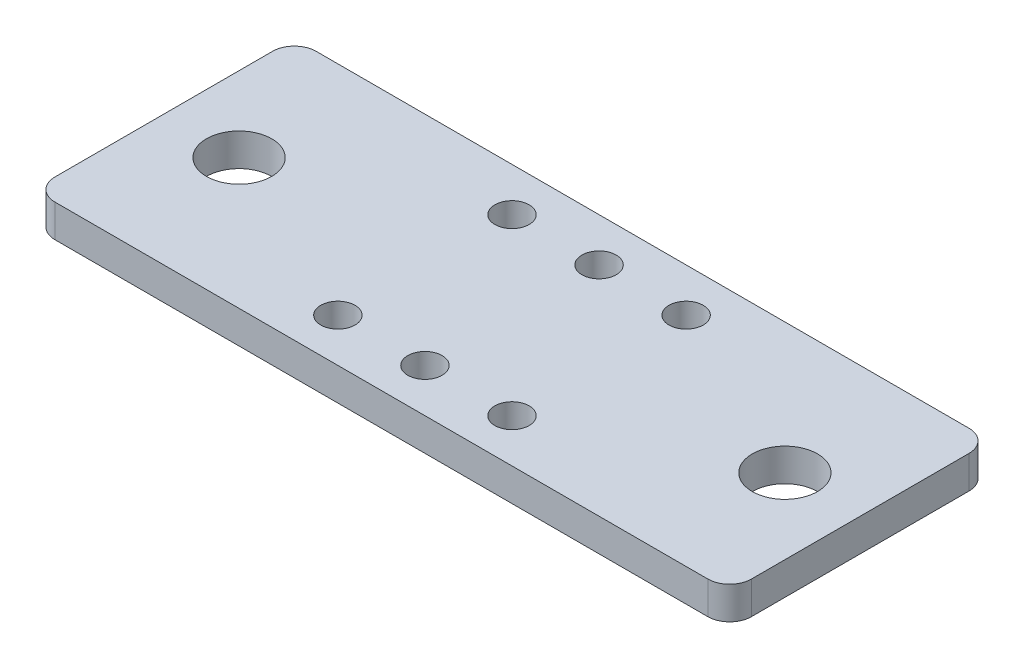
from build123d import *

# Parameters (mm, degrees)
ESQUISSE1_W                   = 101.6
ESQUISSE1_H                   = 38.1
T_LE_DE_BASE_PLI_E1_DEPTH     = 4.76
ESQUISSE13_R                  = 4.7625
ENL_V_MAT_EXTRU_3_DEPTH       = 55.46283228
DIAM_TRE_DU_PER_AGE_5_0_5_1_D = 5
R_P_TITION_LIN_AIRE1_COUNT    = 2
R_P_TITION_LIN_AIRE1_PITCH    = 25.4
CONG_2_R                      = 3.175


# Sheet-metal steps are written as plain solids
with BuildPart() as part:
    # Esquisse1 → Tôle de base pliée1 (new body)
    with BuildSketch(Plane(origin=(0, 0, 0), x_dir=(1, 0, 0), z_dir=(0, 1, 0))):
        Rectangle(ESQUISSE1_W, ESQUISSE1_H)
    extrude(amount=-T_LE_DE_BASE_PLI_E1_DEPTH)

    # Esquisse13 → Enlèv. mat.-Extru.3 (cut, through all)
    with BuildSketch(Plane(origin=(0, 0, 0), x_dir=(1, 0, 0), z_dir=(0, 1, 0))):
        with Locations(Location((-39.8145, 0, 0), (0, 0, 270))):
            Circle(ESQUISSE13_R)
        with Locations(Location((39.8145, 0, 0), (0, 0, 90))):
            Circle(ESQUISSE13_R)
    extrude(amount=-ENL_V_MAT_EXTRU_3_DEPTH, mode=Mode.SUBTRACT)

    # Diamètre du perçage Ø5.0 (5)1 (through all)
    with Locations(Plane(origin=(0, 0, 0), x_dir=(1, 0, 0), z_dir=(0, 1, 0))):
        with Locations((-12.7, 12.7), (0, 12.7), (12.7, 12.7)):
            diam_tre_du_per_age_5_0_5_1 = Hole(DIAM_TRE_DU_PER_AGE_5_0_5_1_D / 2)

    # Répétition linéaire1: Diamètre du perçage Ø5.0 (5)1 ×2
    with Locations(*[(0, 0, i * R_P_TITION_LIN_AIRE1_PITCH) for i in range(1, R_P_TITION_LIN_AIRE1_COUNT)]):
        add(diam_tre_du_per_age_5_0_5_1, mode=Mode.SUBTRACT)

    # Congé2
    cong_2_edges = [part.edges().sort_by_distance(p)[0] for p in [
        (-50.8, -2.38, -19.05),
        (50.8, -2.38, -19.05),
        (50.8, -2.38, 19.05),
        (-50.8, -2.38, 19.05),
    ]]
    fillet(cong_2_edges, radius=CONG_2_R)


solid = part.part
